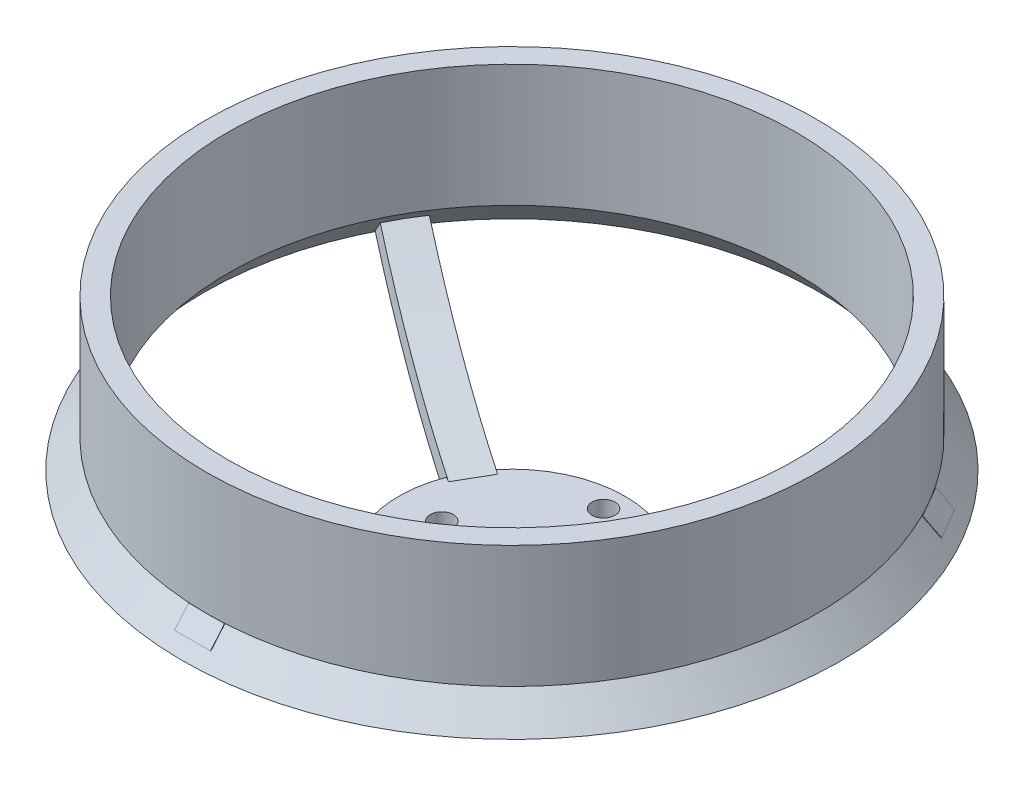
from build123d import *

# Parameters (mm, degrees)
SKETCH_1_R               = 15.75
SKETCH_1_R_2             = 1.6
SKETCH_1_R_3             = 3
EXTRUDE_1_DEPTH          = 4
SKETCH_2_R               = 42.5
SKETCH_2_R_2             = 39.5
EXTRUDE_2_DEPTH          = 17
EXTRUDE_6_DEPTH          = 2.5
PATTERN_CIRCULAR_4_COUNT = 3


with BuildPart() as part:
    # 草图1 → 凸台-拉伸1 (new body)
    with BuildSketch(Plane(origin=(0, 0, 0), x_dir=(1, 0, 0), z_dir=(0, 1, 0))):
        Circle(SKETCH_1_R)
        with Locations((0, 12.75)):
            Circle(SKETCH_1_R_2, mode=Mode.SUBTRACT)
        with Locations((0, -12.75)):
            Circle(SKETCH_1_R_2, mode=Mode.SUBTRACT)
        with Locations((-9.75, 0)):
            Circle(SKETCH_1_R_2, mode=Mode.SUBTRACT)
        with Locations((9.75, 0)):
            Circle(SKETCH_1_R_2, mode=Mode.SUBTRACT)
        Circle(SKETCH_1_R_3, mode=Mode.SUBTRACT)
    extrude(amount=EXTRUDE_1_DEPTH)



with BuildPart() as body_2:
    # 草图2 → 凸台-拉伸2 (new body)
    with BuildSketch(Plane(origin=(0, 19, 0), x_dir=(1, 0, 0), z_dir=(0, 1, 0))):
        Circle(SKETCH_2_R)
        Circle(SKETCH_2_R_2, mode=Mode.SUBTRACT)
    extrude(amount=EXTRUDE_2_DEPTH)

    # 草图5 → 旋转3 (revolve)
    with BuildSketch(Plane.XY):
        Polygon((-39.5, 19), (-42.5, 19), (-45.856398525, 15), (-42.856398525, 15), align=None)
    revolve(axis=Axis((0, 19, 0), (0, -1, 0)))


with BuildPart() as part_1:
    add(part.part)

    add(body_2.part)  # 凸台-拉伸6 merges body 2
    # 草图6 → 凸台-拉伸6 (add, symmetric)
    with BuildSketch(Plane(origin=(0, 0, 0), x_dir=(0, 0, -1), z_dir=(1, 0, 0))):
        with BuildLine():
            Line((-14.75, 4), (-14.75, 1))
            ThreePointArc((-14.75, 1), (-30.538612165, 7.056398784), (-44.428366179, 16.701862678))
            Line((-44.428366179, 16.701862678), (-42.5, 19))
            ThreePointArc((-42.5, 19), (-29.491238263, 9.897459214), (-14.75, 4))
        make_face()
    extrude_6 = extrude(amount=EXTRUDE_6_DEPTH, both=True)

    # 阵列(圆周)4: 凸台-拉伸6 ×3 about axis
    pattern_circular_4_axis = Axis((0, 4, 0), (0, -1, 0))
    for i in range(1, PATTERN_CIRCULAR_4_COUNT):
        add(extrude_6.rotate(pattern_circular_4_axis, i * 360 / PATTERN_CIRCULAR_4_COUNT))


solid = part_1.part
